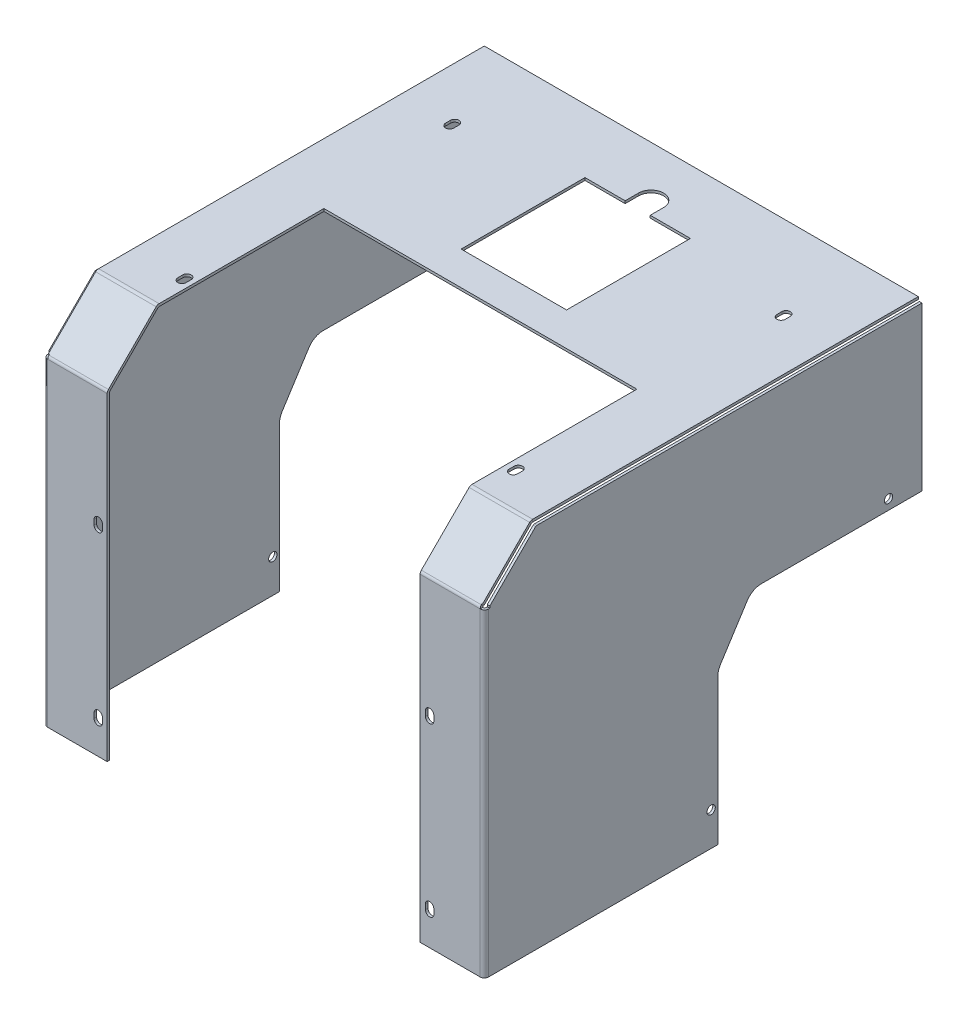
from build123d import *

# Parameters (mm, degrees)
EXTRUDE_1_DEPTH       = 131.7
CUT_EXTRUDE_1_DEPTH   = 433.231488904
SHEET_START           = -129.846446609
SHEET_METAL_1_DEPTH   = 259.339339828
SHEET_START_2         = 129.492893219
SHEET_METAL_1_2_DEPTH = 3.507106781
SHEET_START_3         = -133
SHEET_METAL_1_3_DEPTH = 3.153553391
SHEET_START_4         = -130.2
SHEET_METAL_1_4_DEPTH = 1
SHEET_START_5         = 129.2
SHEET_METAL_1_5_DEPTH = 0.292893219
SHEET_START_6         = -1
SHEET_METAL_1_6_DEPTH = 220.292893219
SHEET_METAL_1_7_DEPTH = 190.464466094
SKETCH_5_W            = 187
SKETCH_5_H            = 129.5
SKETCH_5_W_2          = 63
SKETCH_5_H_2          = 74
CUT_EXTRUDE_2_DEPTH   = 368.136745641
CUT_EXTRUDE_3_REACH   = 369.137
CUT_EXTRUDE_4_REACH   = 369.137
CUT_EXTRUDE_5_REACH   = 369.137
HOLE_WIZARD_M4_1_D    = 5


with BuildPart() as part:
    # Sketch 1 → 凸台-拉伸1 (new, symmetric)
    with BuildSketch(Plane(origin=(0, 0, 0), x_dir=(0, 0, -1), z_dir=(1, 0, 0))):
        Polygon((0, 0), (0, 191.5), (30, 221.5), (261.5, 221.5), (261.5, 0), align=None)
    extrude(amount=EXTRUDE_1_DEPTH, both=True)

    # 草图4 → 切除-拉伸1 (cut, through all)
    with BuildSketch(Plane(origin=(131.7, 0, 0), x_dir=(0, 0, -1), z_dir=(1, 0, 0))):
        with BuildLine():
            Line((261.5, 0), (139.5, 0))
            Line((139.5, 0), (139.5, 87.07156618))
            ThreePointArc((139.5, 87.07156618), (139.90304117, 89.881972061), (141.079676243, 92.465836087))
            Line((141.079676243, 92.465836087), (157.049454159, 117.394269907))
            ThreePointArc((157.049454159, 117.394269907), (160.670960305, 120.773331724), (165.469777916, 122))
            Line((165.469777916, 122), (261.5, 122))
            Line((261.5, 122), (261.5, 0))
        make_face()
    extrude(amount=-CUT_EXTRUDE_1_DEPTH, mode=Mode.SUBTRACT)

    # Sheet Metal 1: read off the stored shape, not the designer's step
    # Sheet Metal 1 outline → Sheet Metal 1 (cut)
    with BuildSketch(Plane.YZ.offset(SHEET_START)):
        with BuildLine():
            Line((220, -261.5), (220, -31.035533906))
            ThreePointArc((220, -31.035533906), (219.923879533, -30.652850474), (219.707106781, -30.328427125))
            Line((219.707106781, -30.328427125), (191.171572875, -1.792893219))
            ThreePointArc((191.171572875, -1.792893219), (190.847149526, -1.576120467), (190.464466094, -1.5))
            Line((190.464466094, -1.5), (0, -1.5))
            Line((0, -1.5), (0, -139.5))
            Line((0, -139.5), (87.07156618, -139.5))
            ThreePointArc((87.07156618, -139.5), (89.881972061, -139.90304117), (92.465836087, -141.079676243))
            Line((92.465836087, -141.079676243), (117.394269907, -157.049454159))
            ThreePointArc((117.394269907, -157.049454159), (120.773331724, -160.670960305), (122, -165.469777916))
            Line((122, -165.469777916), (122, -261.5))
            Line((122, -261.5), (220, -261.5))
        make_face()
        with BuildLine():
            ThreePointArc((220.767766953, -29.267766953), (221.309698831, -30.078825325), (221.5, -31.035533906))
            Line((221.5, -31.035533906), (221.5, -30))
            Line((221.5, -30), (220.767766953, -29.267766953))
        make_face()
        with BuildLine():
            Line((191.5, 0), (190.464466094, 0))
            ThreePointArc((190.464466094, 0), (191.421174675, -0.190301169), (192.232233047, -0.732233047))
            Line((192.232233047, -0.732233047), (191.5, 0))
        make_face()
    extrude(amount=SHEET_METAL_1_DEPTH, mode=Mode.SUBTRACT)

    # Sheet Metal 1 2 outline → Sheet Metal 1 2 (cut)
    with BuildSketch(Plane.YZ.offset(SHEET_START_2)):
        with BuildLine():
            ThreePointArc((219, -30.621320344), (219.216772751, -30.945743693), (219.292893219, -31.328427125))
            Line((219.292893219, -31.328427125), (219.292893219, -261.5))
            Line((219.292893219, -261.5), (221.5, -261.5))
            Line((221.5, -261.5), (221.5, -30))
            Line((221.5, -30), (191.5, 0))
            Line((191.5, 0), (190.464466094, 0))
            Line((190.464466094, 0), (190.464466094, -3.240249))
            Line((190.464466094, -3.240249), (191.618928656, -3.240249))
            Line((191.618928656, -3.240249), (219, -30.621320344))
        make_face()
    extrude(amount=SHEET_METAL_1_2_DEPTH, mode=Mode.SUBTRACT)

    # Sheet Metal 1 3 outline → Sheet Metal 1 3 (cut)
    with BuildSketch(Plane.YZ.offset(SHEET_START_3)):
        with BuildLine():
            Line((219.646446609, -31.181980515), (219.646446609, -261.5))
            Line((219.646446609, -261.5), (221.5, -261.5))
            Line((221.5, -261.5), (221.5, -30))
            Line((221.5, -30), (191.5, 0))
            Line((191.5, 0), (190.464466094, 0))
            Line((190.464466094, 0), (190.464466094, -3.240249))
            Line((190.464466094, -3.240249), (192.118928656, -3.240249))
            Line((192.118928656, -3.240249), (219.353553391, -30.474873734))
            ThreePointArc((219.353553391, -30.474873734), (219.570326142, -30.799297083), (219.646446609, -31.181980515))
        make_face()
    extrude(amount=SHEET_METAL_1_3_DEPTH, mode=Mode.SUBTRACT)

    # Sheet Metal 1 4 outline → Sheet Metal 1 4 (cut)
    with BuildSketch(Plane.YZ.offset(SHEET_START_4)):
        with BuildLine():
            ThreePointArc((219, -30.621320344), (219.216772751, -30.945743693), (219.292893219, -31.328427125))
            Line((219.292893219, -31.328427125), (219.292893219, -261.5))
            Line((219.292893219, -261.5), (219.646446609, -261.5))
            Line((219.646446609, -261.5), (219.646446609, -31.181980515))
            ThreePointArc((219.646446609, -31.181980515), (219.570326142, -30.799297083), (219.353553391, -30.474873734))
            Line((219.353553391, -30.474873734), (192.118928656, -3.240249))
            Line((192.118928656, -3.240249), (191.618928656, -3.240249))
            Line((191.618928656, -3.240249), (219, -30.621320344))
        make_face()
        with BuildLine():
            Line((190.464466094, 0), (190.464466094, -1.5))
            ThreePointArc((190.464466094, -1.5), (190.847149526, -1.576120467), (191.171572875, -1.792893219))
            Line((191.171572875, -1.792893219), (191.474873734, -2.096194078))
            Line((191.474873734, -2.096194078), (192.535533906, -1.035533906))
            Line((192.535533906, -1.035533906), (192.232233047, -0.732233047))
            ThreePointArc((192.232233047, -0.732233047), (191.421174675, -0.190301169), (190.464466094, 0))
        make_face()
    extrude(amount=SHEET_METAL_1_4_DEPTH, mode=Mode.SUBTRACT)

    # Sheet Metal 1 5 outline → Sheet Metal 1 5 (cut)
    with BuildSketch(Plane.YZ.offset(SHEET_START_5)):
        with BuildLine():
            Line((190.464466094, 0), (190.464466094, -1.5))
            ThreePointArc((190.464466094, -1.5), (190.847149526, -1.576120467), (191.171572875, -1.792893219))
            Line((191.171572875, -1.792893219), (191.474873734, -2.096194078))
            Line((191.474873734, -2.096194078), (192.535533906, -1.035533906))
            Line((192.535533906, -1.035533906), (192.232233047, -0.732233047))
            ThreePointArc((192.232233047, -0.732233047), (191.421174675, -0.190301169), (190.464466094, 0))
        make_face()
    extrude(amount=SHEET_METAL_1_5_DEPTH, mode=Mode.SUBTRACT)

    # Sheet Metal 1 6 outline → Sheet Metal 1 6 (cut)
    with BuildSketch(Plane(origin=(0, 0, 0), x_dir=(1, 0, 0), z_dir=(0, 1, 0)).offset(SHEET_START_6)):
        with BuildLine():
            Line((131.7, 0), (131.7, 2.5))
            ThreePointArc((131.7, 2.5), (130.967766953, 0.732233047), (129.2, 0))
            Line((129.2, 0), (131.7, 0))
        make_face()
        with BuildLine():
            Line((-131.7, 0), (-129.2, 0))
            ThreePointArc((-129.2, 0), (-130.967766953, 0.732233047), (-131.7, 2.5))
            Line((-131.7, 2.5), (-131.7, 0))
        make_face()
        with BuildLine():
            ThreePointArc((129.492893219, 1.543854843), (130.004019035, 1.905396443), (130.2, 2.5))
            Line((130.2, 2.5), (130.2, 261.5))
            Line((130.2, 261.5), (129.492893219, 261.5))
            Line((129.492893219, 261.5), (129.492893219, 1.543854843))
        make_face()
        with BuildLine():
            Line((-129.846446609, 1.737040774), (-129.846446609, 261.5))
            Line((-129.846446609, 261.5), (-130.2, 261.5))
            Line((-130.2, 261.5), (-130.2, 2.5))
            ThreePointArc((-130.2, 2.5), (-130.10731654, 2.079551792), (-129.846446609, 1.737040774))
        make_face()
    extrude(amount=SHEET_METAL_1_6_DEPTH, mode=Mode.SUBTRACT)

    # Sheet Metal 1 7 outline → Sheet Metal 1 7 (add)
    with BuildSketch(Plane(origin=(0, 0, 0), x_dir=(1, 0, 0), z_dir=(0, 1, 0))):
        with BuildLine():
            Line((129.492893219, 1.5), (129.492893219, 1.543854843))
            ThreePointArc((129.492893219, 1.543854843), (129.348079105, 1.51102448), (129.2, 1.5))
            Line((129.2, 1.5), (129.492893219, 1.5))
        make_face()
        with BuildLine():
            Line((-129.846446609, 1.5), (-129.2, 1.5))
            ThreePointArc((-129.2, 1.5), (-129.5442679, 1.561128543), (-129.846446609, 1.737040774))
            Line((-129.846446609, 1.737040774), (-129.846446609, 1.5))
        make_face()
    extrude(amount=SHEET_METAL_1_7_DEPTH)

    # 草图5 → 切除-拉伸2 (cut, through all)
    with BuildSketch(Plane(origin=(0, 221.5, 0), x_dir=(1, 0, 0), z_dir=(0, 1, 0))):
        with Locations((-0.176776695, 64.75)):
            Rectangle(SKETCH_5_W, SKETCH_5_H)
        with Locations((-0.176776695, 186.5)):
            Rectangle(SKETCH_5_W_2, SKETCH_5_H_2)
    extrude(amount=-CUT_EXTRUDE_2_DEPTH, mode=Mode.SUBTRACT)

    # 草图6 → 切除-拉伸3 (cut, up to next)
    with BuildSketch(Plane(origin=(0, 221.5, 0), x_dir=(1, 0, 0), z_dir=(0, 1, 0)), mode=Mode.PRIVATE) as cut_extrude_3_sk1:
        with BuildLine():
            Line((-7.676776695, 231.5), (-7.676776695, 223.5))
            Line((-7.676776695, 223.5), (7.323223305, 223.5))
            Line((7.323223305, 223.5), (7.323223305, 231.5))
            ThreePointArc((7.323223305, 231.5), (-0.176776695, 239), (-7.676776695, 231.5))
        make_face()
    cut_extrude_3_tool1 = extrude(cut_extrude_3_sk1.sketch, amount=-CUT_EXTRUDE_3_REACH, mode=Mode.PRIVATE) & part.part
    add(cut_extrude_3_tool1.solids().sort_by_distance((-0.176777, 221.5, -230.54611))[0], mode=Mode.SUBTRACT)

    # 草图7 → 切除-拉伸4 (cut, up to next)
    with BuildSketch(Plane(origin=(0, 221.5, 0), x_dir=(1, 0, 0), z_dir=(0, 1, 0)), mode=Mode.PRIVATE) as cut_extrude_4_sk1:
        with BuildLine():
            Line((101.5, 213), (101.5, 210))
            ThreePointArc((101.5, 210), (99, 207.5), (96.5, 210))
            Line((96.5, 210), (96.5, 213))
            ThreePointArc((96.5, 213), (99, 215.5), (101.5, 213))
        make_face()
    cut_extrude_4_tool1 = extrude(cut_extrude_4_sk1.sketch, amount=-CUT_EXTRUDE_4_REACH, mode=Mode.PRIVATE) & part.part
    # 草图7 → 切除-拉伸4 (cut, up to next)
    with BuildSketch(Plane(origin=(0, 221.5, 0), x_dir=(1, 0, 0), z_dir=(0, 1, 0)), mode=Mode.PRIVATE) as cut_extrude_4_sk2:
        with BuildLine():
            Line((101.5, 50), (101.5, 53))
            ThreePointArc((101.5, 53), (99, 55.5), (96.5, 53))
            Line((96.5, 53), (96.5, 50))
            ThreePointArc((96.5, 50), (99, 47.5), (101.5, 50))
        make_face()
    cut_extrude_4_tool2 = extrude(cut_extrude_4_sk2.sketch, amount=-CUT_EXTRUDE_4_REACH, mode=Mode.PRIVATE) & part.part
    # 草图7 → 切除-拉伸4 (cut, up to next)
    with BuildSketch(Plane(origin=(0, 221.5, 0), x_dir=(1, 0, 0), z_dir=(0, 1, 0)), mode=Mode.PRIVATE) as cut_extrude_4_sk3:
        with BuildLine():
            Line((-101.5, 213), (-101.5, 210))
            ThreePointArc((-101.5, 210), (-99, 207.5), (-96.5, 210))
            Line((-96.5, 210), (-96.5, 213))
            ThreePointArc((-96.5, 213), (-99, 215.5), (-101.5, 213))
        make_face()
    cut_extrude_4_tool3 = extrude(cut_extrude_4_sk3.sketch, amount=-CUT_EXTRUDE_4_REACH, mode=Mode.PRIVATE) & part.part
    # 草图7 → 切除-拉伸4 (cut, up to next)
    with BuildSketch(Plane(origin=(0, 221.5, 0), x_dir=(1, 0, 0), z_dir=(0, 1, 0)), mode=Mode.PRIVATE) as cut_extrude_4_sk4:
        with BuildLine():
            Line((-101.5, 50), (-101.5, 53))
            ThreePointArc((-101.5, 53), (-99, 55.5), (-96.5, 53))
            Line((-96.5, 53), (-96.5, 50))
            ThreePointArc((-96.5, 50), (-99, 47.5), (-101.5, 50))
        make_face()
    cut_extrude_4_tool4 = extrude(cut_extrude_4_sk4.sketch, amount=-CUT_EXTRUDE_4_REACH, mode=Mode.PRIVATE) & part.part
    add(cut_extrude_4_tool1.solids().sort_by_distance((99, 221.5, -211.5))[0], mode=Mode.SUBTRACT)
    add(cut_extrude_4_tool2.solids().sort_by_distance((99, 221.5, -51.5))[0], mode=Mode.SUBTRACT)
    add(cut_extrude_4_tool3.solids().sort_by_distance((-99, 221.5, -211.5))[0], mode=Mode.SUBTRACT)
    add(cut_extrude_4_tool4.solids().sort_by_distance((-99, 221.5, -51.5))[0], mode=Mode.SUBTRACT)

    # 草图8 → 切除-拉伸5 (cut, up to next)
    with BuildSketch(Plane.XY, mode=Mode.PRIVATE) as cut_extrude_5_sk1:
        with BuildLine():
            Line((-96.5, 121.5), (-96.5, 118.5))
            ThreePointArc((-96.5, 118.5), (-99, 116), (-101.5, 118.5))
            Line((-101.5, 118.5), (-101.5, 121.5))
            ThreePointArc((-101.5, 121.5), (-99, 124), (-96.5, 121.5))
        make_face()
    cut_extrude_5_tool1 = extrude(cut_extrude_5_sk1.sketch, amount=-CUT_EXTRUDE_5_REACH, mode=Mode.PRIVATE) & part.part
    # 草图8 → 切除-拉伸5 (cut, up to next)
    with BuildSketch(Plane.XY, mode=Mode.PRIVATE) as cut_extrude_5_sk2:
        with BuildLine():
            Line((96.5, 121.5), (96.5, 118.5))
            ThreePointArc((96.5, 118.5), (99, 116), (101.5, 118.5))
            Line((101.5, 118.5), (101.5, 121.5))
            ThreePointArc((101.5, 121.5), (99, 124), (96.5, 121.5))
        make_face()
    cut_extrude_5_tool2 = extrude(cut_extrude_5_sk2.sketch, amount=-CUT_EXTRUDE_5_REACH, mode=Mode.PRIVATE) & part.part
    # 草图8 → 切除-拉伸5 (cut, up to next)
    with BuildSketch(Plane.XY, mode=Mode.PRIVATE) as cut_extrude_5_sk3:
        with BuildLine():
            Line((-96.5, 18.5), (-96.5, 21.5))
            ThreePointArc((-96.5, 21.5), (-99, 24), (-101.5, 21.5))
            Line((-101.5, 21.5), (-101.5, 18.5))
            ThreePointArc((-101.5, 18.5), (-99, 16), (-96.5, 18.5))
        make_face()
    cut_extrude_5_tool3 = extrude(cut_extrude_5_sk3.sketch, amount=-CUT_EXTRUDE_5_REACH, mode=Mode.PRIVATE) & part.part
    # 草图8 → 切除-拉伸5 (cut, up to next)
    with BuildSketch(Plane.XY, mode=Mode.PRIVATE) as cut_extrude_5_sk4:
        with BuildLine():
            Line((96.5, 18.5), (96.5, 21.5))
            ThreePointArc((96.5, 21.5), (99, 24), (101.5, 21.5))
            Line((101.5, 21.5), (101.5, 18.5))
            ThreePointArc((101.5, 18.5), (99, 16), (96.5, 18.5))
        make_face()
    cut_extrude_5_tool4 = extrude(cut_extrude_5_sk4.sketch, amount=-CUT_EXTRUDE_5_REACH, mode=Mode.PRIVATE) & part.part
    add(cut_extrude_5_tool1.solids().sort_by_distance((-99, 120, 0))[0], mode=Mode.SUBTRACT)
    add(cut_extrude_5_tool2.solids().sort_by_distance((99, 120, 0))[0], mode=Mode.SUBTRACT)
    add(cut_extrude_5_tool3.solids().sort_by_distance((-99, 20, 0))[0], mode=Mode.SUBTRACT)
    add(cut_extrude_5_tool4.solids().sort_by_distance((99, 20, 0))[0], mode=Mode.SUBTRACT)

    # M4 间隙孔1 (through all)
    with Locations(Plane.ZY.offset(131.7)):
        with Locations((-241.5, 128), (-135.5, 20)):
            Hole(HOLE_WIZARD_M4_1_D / 2)


solid = part.part
